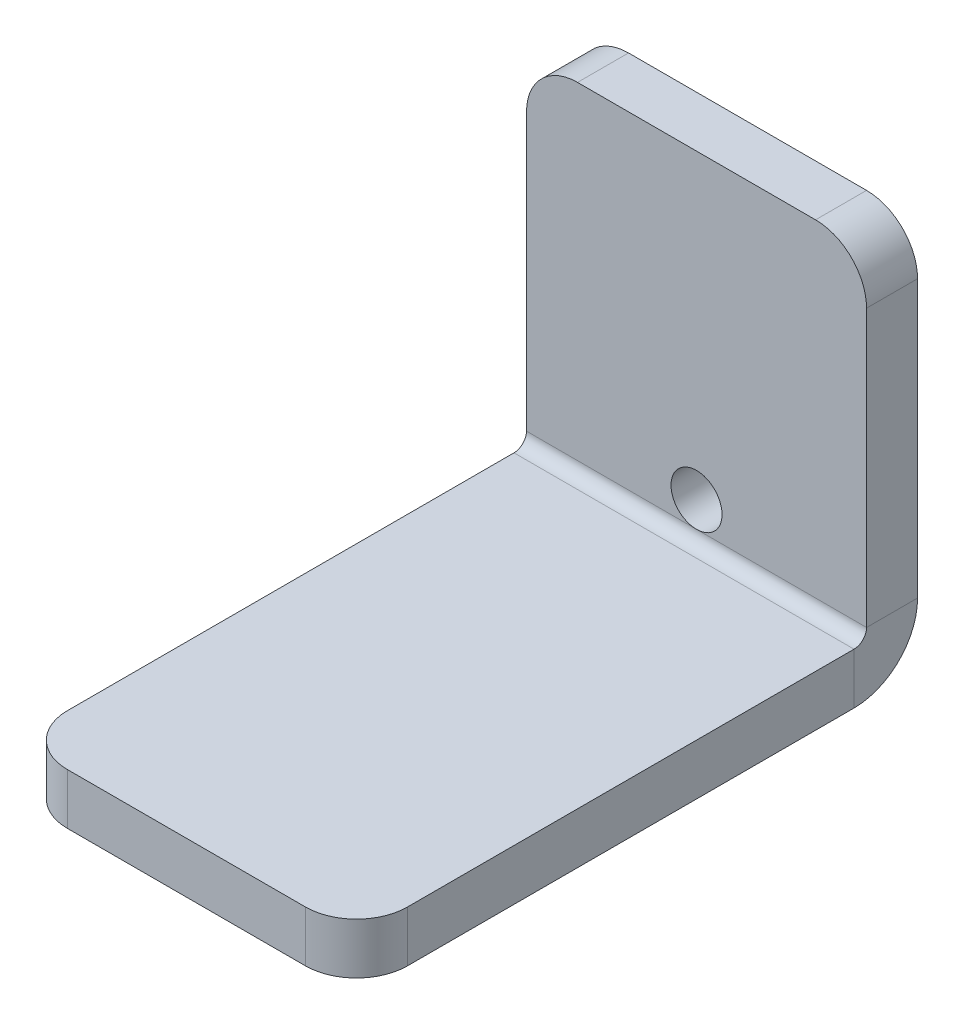
from build123d import *

# Parameters (mm, degrees)
BASE_FLANGE1_DEPTH = 20
FILLET1_R          = 3
SKETCH5_R          = 1.5
CUT_EXTRUDE1_DEPTH = 44.462627624


# Sheet-metal steps are written as plain solids
with BuildPart() as part:
    # Sketch1 → Base-Flange1 (new body)
    with BuildSketch(Plane(origin=(0, 0, 0), x_dir=(0, 0, -1), z_dir=(1, 0, 0))):
        with BuildLine():
            Line((0, 0), (29.2634, 0))
            ThreePointArc((29.2634, 0), (29.784254855, 0.215745145), (30, 0.7366))
            Line((30, 0.7366), (30, 20))
            Line((30, 20), (33, 20))
            Line((33, 20), (33, 0.7366))
            ThreePointArc((33, 0.7366), (31.905575199, -1.905575199), (29.2634, -3))
            Line((29.2634, -3), (0, -3))
            Line((0, -3), (0, 0))
        make_face()
    extrude(amount=BASE_FLANGE1_DEPTH)

    # Fillet1
    fillet1_edges = [part.edges().sort_by_distance(p)[0] for p in [
        (20, -1.5, 0),
        (20, 20, -31.5),
        (0, -1.5, 0),
        (0, 20, -31.5),
    ]]
    fillet(fillet1_edges, radius=FILLET1_R)

    # Sketch5 → Cut-Extrude1 (cut, through all)
    with BuildSketch(Plane(origin=(0, 0, -33), x_dir=(-1, 0, 0), z_dir=(0, 0, -1))):
        with Locations(Location((-10, 2.2366, 0), (0, 0, 270))):
            Circle(SKETCH5_R)
    extrude(amount=-CUT_EXTRUDE1_DEPTH, mode=Mode.SUBTRACT)


solid = part.part
